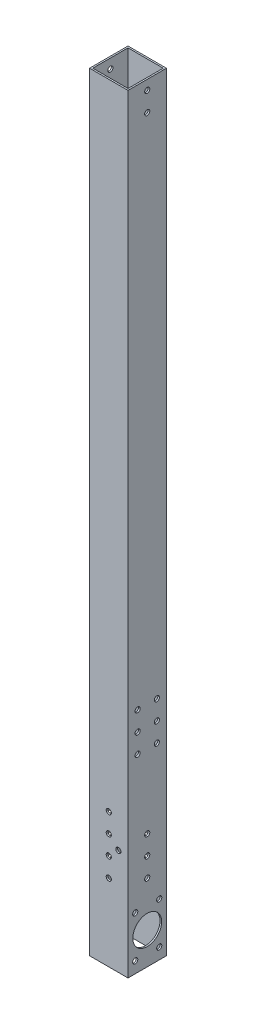
from build123d import *

# Parameters (mm, degrees)
SKETCH1_W           = 38.1
SKETCH1_H           = 38.1
SKETCH1_W_2         = 34.925
SKETCH1_H_2         = 34.925
BOSS_EXTRUDE1_DEPTH = 762
SKETCH2_R           = 2.5527
CUT_EXTRUDE1_DEPTH  = 764.189696275
SKETCH3_R           = 2.5527
CUT_EXTRUDE2_DEPTH  = 764.189696275
SKETCH4_R           = 14.2875
SKETCH4_R_2         = 2.5527
CUT_EXTRUDE3_DEPTH  = 764.189696275


with BuildPart() as part:
    # Sketch1 → Boss-Extrude1 (new body)
    with BuildSketch(Plane(origin=(0, 0, 0), x_dir=(1, 0, 0), z_dir=(0, 1, 0))):
        Rectangle(SKETCH1_W, SKETCH1_H)
        Rectangle(SKETCH1_W_2, SKETCH1_H_2, mode=Mode.SUBTRACT)
    extrude(amount=BOSS_EXTRUDE1_DEPTH)

    # Sketch2 → Cut-Extrude1 (cut, through all)
    with BuildSketch(Plane.XY.offset(19.05)):
        with Locations((0, 76.2)):
            Circle(SKETCH2_R)
        with Locations((0, 95.25)):
            Circle(SKETCH2_R)
        with Locations((0, 114.3)):
            Circle(SKETCH2_R)
        with Locations((0, 133.35)):
            Circle(SKETCH2_R)
        with Locations((9.525, 104.775)):
            Circle(SKETCH2_R)
    extrude(amount=-CUT_EXTRUDE1_DEPTH, mode=Mode.SUBTRACT)

    # Sketch3 → Cut-Extrude2 (cut, through all)
    with BuildSketch(Plane(origin=(19.05, 0, 0), x_dir=(0, 0, -1), z_dir=(1, 0, 0))):
        with Locations((0, 76.2)):
            Circle(SKETCH3_R)
        with Locations((0, 95.25)):
            Circle(SKETCH3_R)
        with Locations((0, 114.3)):
            Circle(SKETCH3_R)
        with Locations((-9.525, 225.425)):
            Circle(SKETCH3_R)
        with Locations((-9.525, 206.375)):
            Circle(SKETCH3_R)
        with Locations((-9.525, 187.325)):
            Circle(SKETCH3_R)
        with Locations((9.525, 187.325)):
            Circle(SKETCH3_R)
        with Locations((9.525, 206.375)):
            Circle(SKETCH3_R)
        with Locations((9.525, 225.425)):
            Circle(SKETCH3_R)
        with Locations((0, 752.475)):
            Circle(SKETCH3_R)
        with Locations((0, 733.425)):
            Circle(SKETCH3_R)
    extrude(amount=-CUT_EXTRUDE2_DEPTH, mode=Mode.SUBTRACT)

    # Sketch4 → Cut-Extrude3 (cut, through all)
    with BuildSketch(Plane(origin=(19.05, 0, 0), x_dir=(0, 0, -1), z_dir=(1, 0, 0))):
        with Locations((0, 31.75)):
            Circle(SKETCH4_R)
        with Locations((-11.90625, 52.372229928)):
            Circle(SKETCH4_R_2)
        with Locations((11.90625, 52.372229928)):
            Circle(SKETCH4_R_2)
        with Locations((11.90625, 11.127770072)):
            Circle(SKETCH4_R_2)
        with Locations((-11.90625, 11.127770072)):
            Circle(SKETCH4_R_2)
    extrude(amount=-CUT_EXTRUDE3_DEPTH, mode=Mode.SUBTRACT)


solid = part.part
